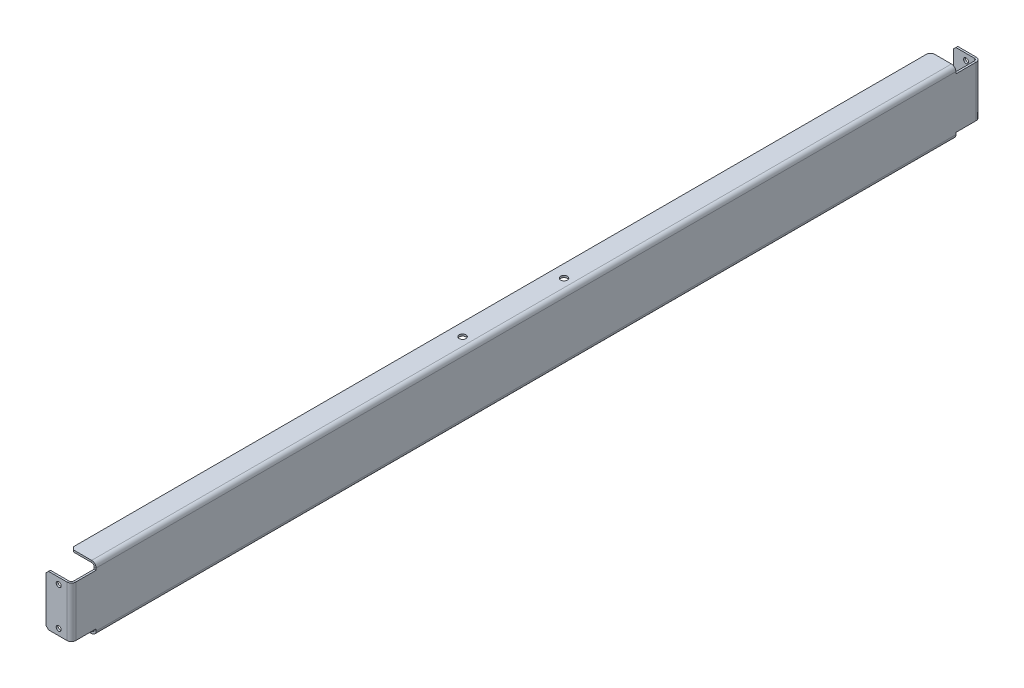
from build123d import *

# Parameters (mm, degrees)
SKETCH1_W                      = 861.06
SKETCH1_H                      = 63.5
BASE_FLANGE1_DEPTH             = 1.89738
EDGE_FLANGE1_STRIP_W           = 12.66952
EDGE_FLANGE1_STRIP_H           = 1.89738
EDGE_FLANGE1_STRIP_CUT_DEPTH   = 861.06
EDGE_FLANGE1_STRIP_2_W         = 12.66952
EDGE_FLANGE1_STRIP_2_H         = 1.89738
EDGE_FLANGE1_STRIP_CUT_2_DEPTH = 861.06
EDGE_FLANGE1_DEPTH             = 861.06
EDGE_FLANGE1_BEND_DEPTH        = 861.06
SKETCH12_W                     = 24.765
SKETCH12_H                     = 50.8
BOSS_EXTRUDE1_DEPTH            = 1.89738
SKETCH13_R                     = 3.3655
CUT_EXTRUDE1_DEPTH             = 461.403026733
EDGE_FLANGE2_STRIP_W           = 12.66952
EDGE_FLANGE2_STRIP_H           = 1.89738
EDGE_FLANGE2_STRIP_CUT_DEPTH   = 50.8
EDGE_FLANGE2_STRIP_2_W         = 12.66952
EDGE_FLANGE2_STRIP_2_H         = 1.89738
EDGE_FLANGE2_STRIP_CUT_2_DEPTH = 50.8
EDGE_FLANGE2_DEPTH             = 50.8
EDGE_FLANGE2_BEND_DEPTH        = 50.8
SKETCH20_R                     = 2.4638
CUT_EXTRUDE2_DEPTH             = 914.154728455
CHAMFER1_SIZE                  = 2.54


# Sheet-metal steps are written as plain solids
with BuildPart() as part:
    # Sketch1 → Base-Flange1 (new body)
    with BuildSketch(Plane(origin=(0, 0, 0), x_dir=(0, 0, -1), z_dir=(1, 0, 0))):
        with Locations((0, 31.75)):
            Rectangle(SKETCH1_W, SKETCH1_H)
    extrude(amount=-BASE_FLANGE1_DEPTH)

    # Edge-Flange1 strip (across the edge) → Edge-Flange1 strip cut (cut)
    with BuildSketch(Plane(origin=(-1.89738, 63.5, 430.53), x_dir=(0, -1, 0), z_dir=(0, 0, -1))):
        with Locations((-1.89738, -0.94869)):
            Rectangle(EDGE_FLANGE1_STRIP_W, EDGE_FLANGE1_STRIP_H)
    extrude(amount=EDGE_FLANGE1_STRIP_CUT_DEPTH, mode=Mode.SUBTRACT)

    # Edge-Flange1 strip 2 (across the edge) → Edge-Flange1 strip cut 2 (cut)
    with BuildSketch(Plane(origin=(-1.89738, 0, -430.53), x_dir=(0, 1, 0), z_dir=(0, 0, 1))):
        with Locations((-1.89738, -0.94869)):
            Rectangle(EDGE_FLANGE1_STRIP_2_W, EDGE_FLANGE1_STRIP_2_H)
    extrude(amount=EDGE_FLANGE1_STRIP_CUT_2_DEPTH, mode=Mode.SUBTRACT)

    # Edge-Flange1 section (across the edge) → Edge-Flange1 (add)
    with BuildSketch(Plane(origin=(-1.89738, 63.5, 430.53), x_dir=(0, -1, 0), z_dir=(0, 0, -1))):
        with BuildLine():
            Line((0, 2.54), (0, 23.50262))
            Line((0, 23.50262), (1.89738, 23.50262))
            Line((1.89738, 23.50262), (1.89738, 2.54))
            ThreePointArc((1.89738, 2.54), (2.641328776, 0.743948776), (4.43738, 0))
            Line((4.43738, 0), (4.43738, -1.89738))
            ThreePointArc((4.43738, -1.89738), (1.299678511, -0.597701489), (0, 2.54))
        make_face()
    extrude(amount=EDGE_FLANGE1_DEPTH)

    # Edge-Flange1 section 2 (across the edge) → Edge-Flange1 bend (add)
    with BuildSketch(Plane(origin=(-1.89738, 0, -430.53), x_dir=(0, 1, 0), z_dir=(0, 0, 1))):
        with BuildLine():
            Line((0, 2.54), (0, 23.50262))
            Line((0, 23.50262), (1.89738, 23.50262))
            Line((1.89738, 23.50262), (1.89738, 2.54))
            ThreePointArc((1.89738, 2.54), (2.641328776, 0.743948776), (4.43738, 0))
            Line((4.43738, 0), (4.43738, -1.89738))
            ThreePointArc((4.43738, -1.89738), (1.299678511, -0.597701489), (0, 2.54))
        make_face()
    extrude(amount=EDGE_FLANGE1_BEND_DEPTH)

    # Sketch12 → Boss-Extrude1 (add)
    with BuildSketch(Plane(origin=(0, 0, 0), x_dir=(0, 0, -1), z_dir=(1, 0, 0))):
        with Locations((-442.9125, 31.75)):
            Rectangle(SKETCH12_W, SKETCH12_H)
    boss_extrude1 = extrude(amount=-BOSS_EXTRUDE1_DEPTH)

    # Mirror1: Boss-Extrude1 across plane
    add(boss_extrude1.mirror(Plane.XY))

    # Sketch13 → Cut-Extrude1 (cut, through all)
    with BuildSketch(Plane(origin=(0, 63.5, 0), x_dir=(1, 0, 0), z_dir=(0, 1, 0))):
        with Locations(Location((-12.7, 50.8, 0), (0, 0, 180))):
            Circle(SKETCH13_R)
        with Locations(Location((-12.7, -50.8, 0), (0, 0, 180))):
            Circle(SKETCH13_R)
    extrude(amount=-CUT_EXTRUDE1_DEPTH, mode=Mode.SUBTRACT)

    # Edge-Flange2 strip (across the edge) → Edge-Flange2 strip cut (cut)
    with BuildSketch(Plane(origin=(-1.89738, 6.35, 455.295), x_dir=(0, 0, -1), z_dir=(0, 1, 0))):
        with Locations((-1.89738, -0.94869)):
            Rectangle(EDGE_FLANGE2_STRIP_W, EDGE_FLANGE2_STRIP_H)
    extrude(amount=EDGE_FLANGE2_STRIP_CUT_DEPTH, mode=Mode.SUBTRACT)

    # Edge-Flange2 strip 2 (across the edge) → Edge-Flange2 strip cut 2 (cut)
    with BuildSketch(Plane(origin=(-1.89738, 57.15, -455.295), x_dir=(0, 0, 1), z_dir=(0, -1, 0))):
        with Locations((-1.89738, -0.94869)):
            Rectangle(EDGE_FLANGE2_STRIP_2_W, EDGE_FLANGE2_STRIP_2_H)
    extrude(amount=EDGE_FLANGE2_STRIP_CUT_2_DEPTH, mode=Mode.SUBTRACT)

    # Edge-Flange2 section (across the edge) → Edge-Flange2 (add)
    with BuildSketch(Plane(origin=(-1.89738, 6.35, 455.295), x_dir=(0, 0, -1), z_dir=(0, 1, 0))):
        with BuildLine():
            Line((0, 2.54), (0, 23.50262))
            Line((0, 23.50262), (1.89738, 23.50262))
            Line((1.89738, 23.50262), (1.89738, 2.54))
            ThreePointArc((1.89738, 2.54), (2.641328776, 0.743948776), (4.43738, 0))
            Line((4.43738, 0), (4.43738, -1.89738))
            ThreePointArc((4.43738, -1.89738), (1.299678511, -0.597701489), (0, 2.54))
        make_face()
    extrude(amount=EDGE_FLANGE2_DEPTH)

    # Edge-Flange2 section 2 (across the edge) → Edge-Flange2 bend (add)
    with BuildSketch(Plane(origin=(-1.89738, 57.15, -455.295), x_dir=(0, 0, 1), z_dir=(0, -1, 0))):
        with BuildLine():
            Line((0, 2.54), (0, 23.50262))
            Line((0, 23.50262), (1.89738, 23.50262))
            Line((1.89738, 23.50262), (1.89738, 2.54))
            ThreePointArc((1.89738, 2.54), (2.641328776, 0.743948776), (4.43738, 0))
            Line((4.43738, 0), (4.43738, -1.89738))
            ThreePointArc((4.43738, -1.89738), (1.299678511, -0.597701489), (0, 2.54))
        make_face()
    extrude(amount=EDGE_FLANGE2_BEND_DEPTH)

    # Sketch20 → Cut-Extrude2 (cut, through all)
    with BuildSketch(Plane.XY.offset(455.295)):
        with Locations((-12.7, 50.8)):
            Circle(SKETCH20_R)
        with Locations((-12.7, 12.7)):
            Circle(SKETCH20_R)
    extrude(amount=-CUT_EXTRUDE2_DEPTH, mode=Mode.SUBTRACT)

    # Chamfer1
    chamfer1_edges = [part.edges().sort_by_distance(p)[0] for p in [
        (-25.4, 6.35, 454.34631),
        (-25.4, 57.15, 454.34631),
        (-25.4, 57.15, -454.34631),
        (-25.4, 6.35, -454.34631),
        (-25.4, 62.55131, 430.53),
        (-25.4, 62.55131, -430.53),
        (-25.4, 0.94869, -430.53),
        (-25.4, 0.94869, 430.53),
    ]]
    chamfer(chamfer1_edges, length=CHAMFER1_SIZE)


solid = part.part
